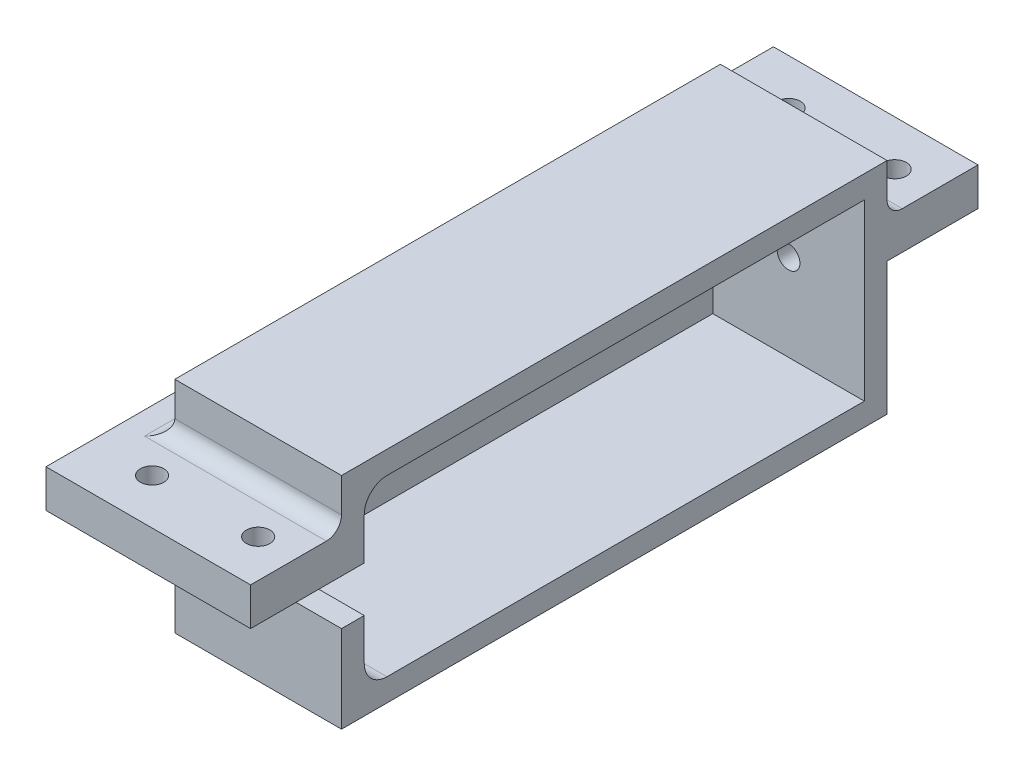
from build123d import *
from build123d.topology import SkipClean

# Parameters (mm, degrees)
SKETCH_1_W             = 72
SKETCH_1_H             = 29
EXTRUDE_1_DEPTH        = 20
CUT_EXTRUDE_1_REACH    = 78.12
SKETCH_2_W             = 11
SKETCH_2_H             = 6
CUT_EXTRUDE_2_REACH    = 78.12
SKETCH_3_R             = 1.5
SKETCH_4_W             = 72
SKETCH_4_H             = 29
SKETCH_4_R             = 3.5
SKETCH_4_W_2           = 5
SKETCH_4_H_2           = 5
SKETCH_4_H_3           = 7
EXTRUDE_2_DEPTH        = 2
SKETCH_6_W             = 22
SKETCH_6_H             = 5
EXTRUDE_3_DEPTH        = 12
SKETCH_7_W             = 22
SKETCH_7_H             = 5
EXTRUDE_4_DEPTH        = 12
EXTRUDE_5_DEPTH        = 5
CUT_EXTRUDE_4_REACH    = 61.492
SKETCH_10_R            = 1.55
FILLET_1_R             = 2
FILLET_1_OF_MIRROR_4_R = 2
SKETCH_11_W            = 152.939509244
SKETCH_11_H            = 68.45292135
CUT_EXTRUDE_5_DEPTH    = 27


with BuildPart() as part:
    # 草圖1 → 填料-伸長1 (new body)
    with BuildSketch(Plane(origin=(0, 0, 0), x_dir=(0, 0, -1), z_dir=(1, 0, 0))):
        Rectangle(SKETCH_1_W, SKETCH_1_H)
        with BuildLine():
            Line((-30, 11.5), (33, 11.5))
            Line((33, 11.5), (33, -11.5))
            Line((33, -11.5), (-30, -11.5))
            ThreePointArc((-30, -11.5), (-32.121320344, -10.621320344), (-33, -8.5))
            Line((-33, -8.5), (-33, 8.5))
            ThreePointArc((-33, 8.5), (-32.121320344, 10.621320344), (-30, 11.5))
        make_face(mode=Mode.SUBTRACT)
    extrude_1 = extrude(amount=EXTRUDE_1_DEPTH)

    # 草圖2 → 除料-伸長1 (cut, up to next)
    with BuildSketch(Plane.XY.offset(36), mode=Mode.PRIVATE) as cut_extrude_1_sk1:
        with Locations((5.5, 0)):
            Rectangle(SKETCH_2_W, SKETCH_2_H)
    cut_extrude_1_tool1 = extrude(cut_extrude_1_sk1.sketch, amount=-CUT_EXTRUDE_1_REACH, mode=Mode.PRIVATE) & part.part
    cut_extrude_1 = cut_extrude_1_tool1.solids().sort_by_distance((5.5, 0, 36))[0]
    add(cut_extrude_1, mode=Mode.SUBTRACT)

    # 草圖3 → 除料-伸長2 (cut, up to next)
    with BuildSketch(Plane(origin=(0, 0, -36), x_dir=(-1, 0, 0), z_dir=(0, 0, -1)), mode=Mode.PRIVATE) as cut_extrude_2_sk1:
        with Locations((-10, 0)):
            Circle(SKETCH_3_R)
    cut_extrude_2_tool1 = extrude(cut_extrude_2_sk1.sketch, amount=-CUT_EXTRUDE_2_REACH, mode=Mode.PRIVATE) & part.part
    cut_extrude_2 = cut_extrude_2_tool1.solids().sort_by_distance((10, 0, -36))[0]
    add(cut_extrude_2, mode=Mode.SUBTRACT)

    # 草圖4 → 填料-伸長2 (add)
    with BuildSketch(Plane(origin=(20, 0, 0), x_dir=(0, 0, -1), z_dir=(1, 0, 0))):
        Rectangle(SKETCH_4_W, SKETCH_4_H)
        with Locations((-21.5, 0)):
            Circle(SKETCH_4_R, mode=Mode.SUBTRACT)
        with Locations((-10.5, 0)):
            Rectangle(SKETCH_4_W_2, SKETCH_4_H_2, mode=Mode.SUBTRACT)
        with Locations((9.5, 0)):
            Rectangle(SKETCH_4_W_2, SKETCH_4_H_3, mode=Mode.SUBTRACT)
    extrude_2 = extrude(amount=EXTRUDE_2_DEPTH)

    # 草圖6 → 填料-伸長3 (add)
    with BuildSketch(Plane.XY.offset(36)):
        with Locations((11, 5.5)):
            Rectangle(SKETCH_6_W, SKETCH_6_H)
    extrude_3 = extrude(amount=EXTRUDE_3_DEPTH)

    # 草圖7 → 填料-伸長4 (add)
    with BuildSketch(Plane(origin=(0, 0, -36), x_dir=(-1, 0, 0), z_dir=(0, 0, -1))):
        with Locations((-11, 5.5)):
            Rectangle(SKETCH_7_W, SKETCH_7_H)
    extrude_4 = extrude(amount=EXTRUDE_4_DEPTH)

    # 草圖9 → 填料-伸長5 (add)
    with SkipClean():  # the faces are left unmerged after this step: merging them gives an invalid solid
        with BuildSketch(Plane(origin=(22, 0, 0), x_dir=(0, 0, -1), z_dir=(1, 0, 0))):
            with BuildLine():
                Line((-48, 3), (-23.302775638, 3))
                ThreePointArc((-23.302775638, 3), (-21.5, 3.5), (-19.697224362, 3))
                Line((-19.697224362, 3), (48, 3))
                Line((48, 3), (48, 8))
                Line((48, 8), (-48, 8))
                Line((-48, 8), (-48, 3))
            make_face()
        extrude_5 = extrude(amount=EXTRUDE_5_DEPTH)

    # 草圖10 → 除料-伸長4 (cut, up to next)
    with BuildSketch(Plane(origin=(0, 8, 0), x_dir=(1, 0, 0), z_dir=(0, 1, 0)), mode=Mode.PRIVATE) as cut_extrude_4_sk1:
        with Locations(Location((5, -42, 0), (0, 0, 270))):
            Circle(SKETCH_10_R)
    cut_extrude_4_tool1 = extrude(cut_extrude_4_sk1.sketch, amount=-CUT_EXTRUDE_4_REACH, mode=Mode.PRIVATE) & part.part
    # 草圖10 → 除料-伸長4 (cut, up to next)
    with BuildSketch(Plane(origin=(0, 8, 0), x_dir=(1, 0, 0), z_dir=(0, 1, 0)), mode=Mode.PRIVATE) as cut_extrude_4_sk2:
        with Locations(Location((19, -42, 0), (0, 0, 270))):
            Circle(SKETCH_10_R)
    cut_extrude_4_tool2 = extrude(cut_extrude_4_sk2.sketch, amount=-CUT_EXTRUDE_4_REACH, mode=Mode.PRIVATE) & part.part
    # 草圖10 → 除料-伸長4 (cut, up to next)
    with BuildSketch(Plane(origin=(0, 8, 0), x_dir=(1, 0, 0), z_dir=(0, 1, 0)), mode=Mode.PRIVATE) as cut_extrude_4_sk3:
        with Locations(Location((19, 42, 0), (0, 0, 270))):
            Circle(SKETCH_10_R)
    cut_extrude_4_tool3 = extrude(cut_extrude_4_sk3.sketch, amount=-CUT_EXTRUDE_4_REACH, mode=Mode.PRIVATE) & part.part
    # 草圖10 → 除料-伸長4 (cut, up to next)
    with BuildSketch(Plane(origin=(0, 8, 0), x_dir=(1, 0, 0), z_dir=(0, 1, 0)), mode=Mode.PRIVATE) as cut_extrude_4_sk4:
        with Locations(Location((5, 42, 0), (0, 0, 270))):
            Circle(SKETCH_10_R)
    cut_extrude_4_tool4 = extrude(cut_extrude_4_sk4.sketch, amount=-CUT_EXTRUDE_4_REACH, mode=Mode.PRIVATE) & part.part
    cut_extrude_4_1 = cut_extrude_4_tool1.solids().sort_by_distance((5, 8, 42))[0]
    add(cut_extrude_4_1, mode=Mode.SUBTRACT)
    cut_extrude_4_2 = cut_extrude_4_tool2.solids().sort_by_distance((19, 8, 42))[0]
    add(cut_extrude_4_2, mode=Mode.SUBTRACT)
    cut_extrude_4_3 = cut_extrude_4_tool3.solids().sort_by_distance((19, 8, -42))[0]
    add(cut_extrude_4_3, mode=Mode.SUBTRACT)
    cut_extrude_4_4 = cut_extrude_4_tool4.solids().sort_by_distance((5, 8, -42))[0]
    add(cut_extrude_4_4, mode=Mode.SUBTRACT)
    cut_extrude_4 = cut_extrude_4_1 + cut_extrude_4_2 + cut_extrude_4_3 + cut_extrude_4_4  # 除料-伸長4 as one shape, for the pattern or mirror that repeats it

    # 圓角1
    # the kernel refuses this fillet: 2 mm, written as the material it adds along each edge
    with BuildSketch(Plane(origin=(22, 8, -36), x_dir=(0, 1, 0), z_dir=(-1, 0, 0)), Plane(origin=(0, 8, 36), x_dir=(0, 1, 0), z_dir=(1, 0, 0))) as fillet_1_piece_1:
        with BuildLine():
            CenterArc((FILLET_1_R, FILLET_1_R), FILLET_1_R, 180, 90)
            Line((0, FILLET_1_R), (0, 0))
            Line((0, 0), (FILLET_1_R, 0))
        make_face()
    extrude(amount=22)
    with BuildSketch(Plane(origin=(22, 8, -36), x_dir=(0, 1, 0), z_dir=(0, 0, 1))) as fillet_1_piece_2:
        with BuildLine():
            CenterArc((FILLET_1_R, -FILLET_1_R), FILLET_1_R, 90, 90)
            Line((0, -FILLET_1_R), (0, 0))
            Line((0, 0), (FILLET_1_R, 0))
        make_face()
    extrude(amount=72)
    with BuildSketch(Plane(origin=(22, 8, -41), x_dir=(0, 1, 0), z_dir=(0, 0, 1))) as fillet_1_piece_3a_section:
        with BuildLine():
            CenterArc((FILLET_1_R, -FILLET_1_R), FILLET_1_R, 90, 90)
            Line((0, -FILLET_1_R), (0, 0))
            Line((0, 0), (FILLET_1_R, 0))
        make_face()
    fillet_1_piece_3a = extrude(amount=77, mode=Mode.PRIVATE)
    fillet_1_piece_3a = split(fillet_1_piece_3a, bisect_by=Plane(origin=(22.452790229, 8.452790229, -36), z_dir=(0, 0, -1)), keep=Keep.TOP, mode=Mode.PRIVATE)
    with BuildSketch(Plane(origin=(27, 8, -36), x_dir=(0, 1, 0), z_dir=(-1, 0, 0))) as fillet_1_piece_3b_section:
        with BuildLine():
            CenterArc((FILLET_1_R, FILLET_1_R), FILLET_1_R, 180, 90)
            Line((0, FILLET_1_R), (0, 0))
            Line((0, 0), (FILLET_1_R, 0))
        make_face()
    fillet_1_piece_3b = extrude(amount=27, mode=Mode.PRIVATE)
    fillet_1_piece_3b = split(fillet_1_piece_3b, bisect_by=Plane(origin=(22, 8.452790229, -36.452790229), z_dir=(1, 0, 0)), keep=Keep.TOP, mode=Mode.PRIVATE)
    fillet_1_piece_3 = fillet_1_piece_3a & fillet_1_piece_3b
    add(fillet_1_piece_3)
    with BuildSketch(Plane(origin=(0, 8, 36), x_dir=(0, 1, 0), z_dir=(1, 0, 0))) as fillet_1_piece_4a_section:
        with BuildLine():
            CenterArc((FILLET_1_R, FILLET_1_R), FILLET_1_R, 180, 90)
            Line((0, FILLET_1_R), (0, 0))
            Line((0, 0), (FILLET_1_R, 0))
        make_face()
    fillet_1_piece_4a = extrude(amount=27, mode=Mode.PRIVATE)
    fillet_1_piece_4a = split(fillet_1_piece_4a, bisect_by=Plane(origin=(22, 8.452790229, 36.452790229), z_dir=(1, 0, 0)), keep=Keep.TOP, mode=Mode.PRIVATE)
    with BuildSketch(Plane(origin=(22, 8, -36), x_dir=(0, 1, 0), z_dir=(0, 0, 1))) as fillet_1_piece_4b_section:
        with BuildLine():
            CenterArc((FILLET_1_R, -FILLET_1_R), FILLET_1_R, 90, 90)
            Line((0, -FILLET_1_R), (0, 0))
            Line((0, 0), (FILLET_1_R, 0))
        make_face()
    fillet_1_piece_4b = extrude(amount=77, mode=Mode.PRIVATE)
    fillet_1_piece_4b = split(fillet_1_piece_4b, bisect_by=Plane(origin=(22.452790229, 8.452790229, 36), z_dir=(0, 0, 1)), keep=Keep.TOP, mode=Mode.PRIVATE)
    fillet_1_piece_4 = fillet_1_piece_4a & fillet_1_piece_4b
    add(fillet_1_piece_4)

    # 鏡射4: 填料-伸長1, 除料-伸長1, 除料-伸長2, 填料-伸長2, 填料-伸長3, 填料-伸長4, 填料-伸長5, 除料-伸長4 across plane
    add(extrude_1.mirror(Plane.ZY))
    add(cut_extrude_1.mirror(Plane.ZY), mode=Mode.SUBTRACT)
    add(cut_extrude_2.mirror(Plane.ZY), mode=Mode.SUBTRACT)
    add(extrude_2.mirror(Plane.ZY))
    add(extrude_3.mirror(Plane.ZY))
    add(extrude_4.mirror(Plane.ZY))
    add(extrude_5.mirror(Plane.ZY))
    add(cut_extrude_4.mirror(Plane.ZY), mode=Mode.SUBTRACT)

    # 圓角1 of 鏡射4
    # the kernel refuses this fillet: 2 mm, written as the material it adds along each edge
    with BuildSketch(Plane(origin=(-22, 8, -36), x_dir=(0, 0, -1), z_dir=(1, 0, 0))) as fillet_1_of_mirror_4_piece_1:
        with BuildLine():
            CenterArc((FILLET_1_OF_MIRROR_4_R, FILLET_1_OF_MIRROR_4_R), FILLET_1_OF_MIRROR_4_R, 180, 90)
            Line((0, FILLET_1_OF_MIRROR_4_R), (0, 0))
            Line((0, 0), (FILLET_1_OF_MIRROR_4_R, 0))
        make_face()
    extrude(amount=27)
    with BuildSketch(Plane(origin=(-22, 8, -36), x_dir=(-1, 0, 0), z_dir=(0, 0, 1))) as fillet_1_of_mirror_4_piece_2:
        with BuildLine():
            CenterArc((FILLET_1_OF_MIRROR_4_R, -FILLET_1_OF_MIRROR_4_R), FILLET_1_OF_MIRROR_4_R, 90, 90)
            Line((0, -FILLET_1_OF_MIRROR_4_R), (0, 0))
            Line((0, 0), (FILLET_1_OF_MIRROR_4_R, 0))
        make_face()
    extrude(amount=72)
    with BuildSketch(Plane(origin=(5, 8, 36), x_dir=(0, 1, 0), z_dir=(-1, 0, 0))) as fillet_1_of_mirror_4_piece_3:
        with BuildLine():
            CenterArc((FILLET_1_OF_MIRROR_4_R, -FILLET_1_OF_MIRROR_4_R), FILLET_1_OF_MIRROR_4_R, 90, 90)
            Line((0, -FILLET_1_OF_MIRROR_4_R), (0, 0))
            Line((0, 0), (FILLET_1_OF_MIRROR_4_R, 0))
        make_face()
    extrude(amount=27)
    with BuildSketch(Plane(origin=(-22, 8, -41), x_dir=(-1, 0, 0), z_dir=(0, 0, 1))) as fillet_1_of_mirror_4_piece_4a_section:
        with BuildLine():
            CenterArc((FILLET_1_OF_MIRROR_4_R, -FILLET_1_OF_MIRROR_4_R), FILLET_1_OF_MIRROR_4_R, 90, 90)
            Line((0, -FILLET_1_OF_MIRROR_4_R), (0, 0))
            Line((0, 0), (FILLET_1_OF_MIRROR_4_R, 0))
        make_face()
    fillet_1_of_mirror_4_piece_4a = extrude(amount=77, mode=Mode.PRIVATE)
    fillet_1_of_mirror_4_piece_4a = split(fillet_1_of_mirror_4_piece_4a, bisect_by=Plane(origin=(-22.452790229, 8.452790229, -36), z_dir=(0, 0, -1)), keep=Keep.TOP, mode=Mode.PRIVATE)
    with BuildSketch(Plane(origin=(-27, 8, -36), x_dir=(0, 0, -1), z_dir=(1, 0, 0))) as fillet_1_of_mirror_4_piece_4b_section:
        with BuildLine():
            CenterArc((FILLET_1_OF_MIRROR_4_R, FILLET_1_OF_MIRROR_4_R), FILLET_1_OF_MIRROR_4_R, 180, 90)
            Line((0, FILLET_1_OF_MIRROR_4_R), (0, 0))
            Line((0, 0), (FILLET_1_OF_MIRROR_4_R, 0))
        make_face()
    fillet_1_of_mirror_4_piece_4b = extrude(amount=27, mode=Mode.PRIVATE)
    fillet_1_of_mirror_4_piece_4b = split(fillet_1_of_mirror_4_piece_4b, bisect_by=Plane(origin=(-22, 8.452790229, -36.452790229), z_dir=(-1, 0, 0)), keep=Keep.TOP, mode=Mode.PRIVATE)
    fillet_1_of_mirror_4_piece_4 = fillet_1_of_mirror_4_piece_4a & fillet_1_of_mirror_4_piece_4b
    add(fillet_1_of_mirror_4_piece_4)
    with BuildSketch(Plane(origin=(0, 8, 36), x_dir=(0, 1, 0), z_dir=(-1, 0, 0))) as fillet_1_of_mirror_4_piece_5a_section:
        with BuildLine():
            CenterArc((FILLET_1_OF_MIRROR_4_R, -FILLET_1_OF_MIRROR_4_R), FILLET_1_OF_MIRROR_4_R, 90, 90)
            Line((0, -FILLET_1_OF_MIRROR_4_R), (0, 0))
            Line((0, 0), (FILLET_1_OF_MIRROR_4_R, 0))
        make_face()
    fillet_1_of_mirror_4_piece_5a = extrude(amount=27, mode=Mode.PRIVATE)
    fillet_1_of_mirror_4_piece_5a = split(fillet_1_of_mirror_4_piece_5a, bisect_by=Plane(origin=(-22, 8.452790229, 36.452790229), z_dir=(-1, 0, 0)), keep=Keep.TOP, mode=Mode.PRIVATE)
    with BuildSketch(Plane(origin=(-22, 8, -36), x_dir=(-1, 0, 0), z_dir=(0, 0, 1))) as fillet_1_of_mirror_4_piece_5b_section:
        with BuildLine():
            CenterArc((FILLET_1_OF_MIRROR_4_R, -FILLET_1_OF_MIRROR_4_R), FILLET_1_OF_MIRROR_4_R, 90, 90)
            Line((0, -FILLET_1_OF_MIRROR_4_R), (0, 0))
            Line((0, 0), (FILLET_1_OF_MIRROR_4_R, 0))
        make_face()
    fillet_1_of_mirror_4_piece_5b = extrude(amount=77, mode=Mode.PRIVATE)
    fillet_1_of_mirror_4_piece_5b = split(fillet_1_of_mirror_4_piece_5b, bisect_by=Plane(origin=(-22.452790229, 8.452790229, 36), z_dir=(0, 0, 1)), keep=Keep.TOP, mode=Mode.PRIVATE)
    fillet_1_of_mirror_4_piece_5 = fillet_1_of_mirror_4_piece_5a & fillet_1_of_mirror_4_piece_5b
    add(fillet_1_of_mirror_4_piece_5)

    # 草圖11 → 除料-伸長5 (cut)
    with BuildSketch(Plane.ZY):
        with Locations((0.508783228, -2.026988218)):
            Rectangle(SKETCH_11_W, SKETCH_11_H)
    extrude(amount=-CUT_EXTRUDE_5_DEPTH, mode=Mode.SUBTRACT)


solid = part.part
